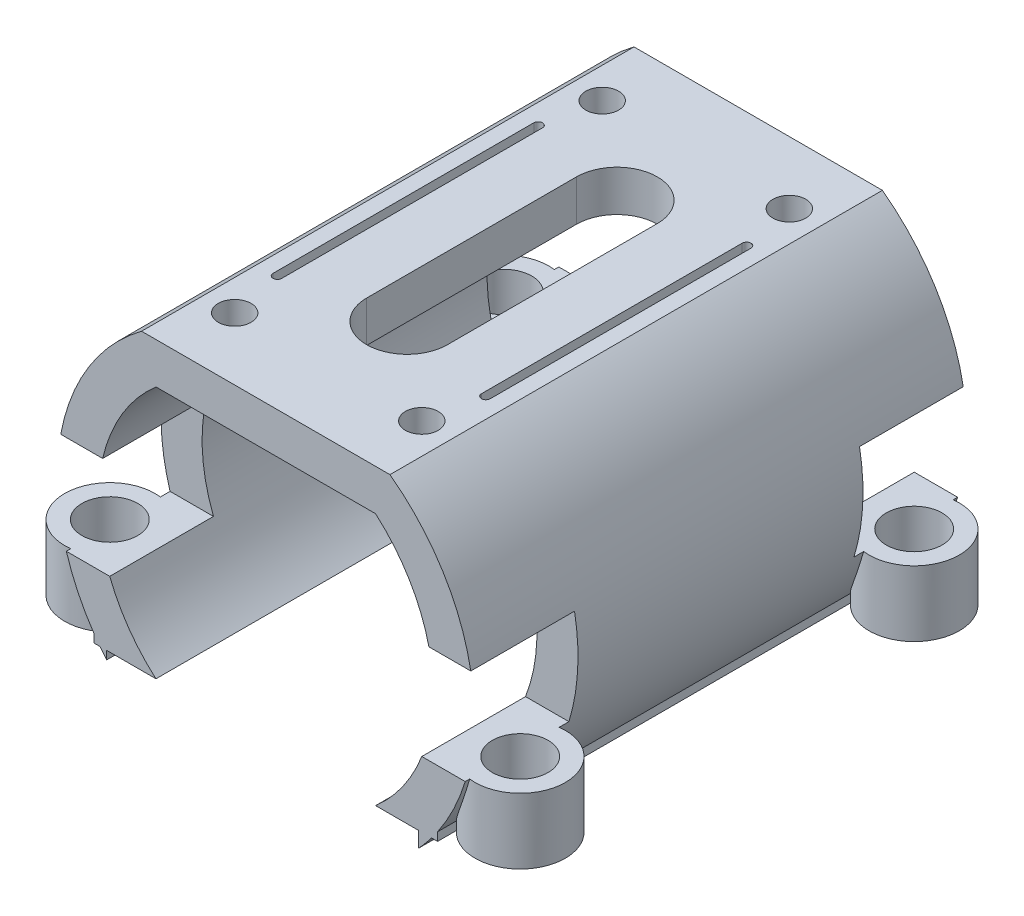
from build123d import *

# Parameters (mm, degrees)
SALIENTE_EXTRUIR1_DEPTH    = 30
VACIADO1_T                 = 2.5
CROQUIS2_W                 = 41.64599518
CROQUIS2_H                 = 31.401201606
CORTAR_EXTRUIR1_DEPTH      = 2.5
CROQUIS3_W                 = 19.002401527
CROQUIS3_H                 = 2.972205444
CORTAR_EXTRUIR2_DEPTH      = 48.3
CROQUIS4_R                 = 2.75
CROQUIS4_R_2               = 1.7
SALIENTE_EXTRUIR2_DEPTH    = 4
SALIENTE_EXTRUIR2_2_DEPTH  = 4
SALIENTE_EXTRUIR2_3_DEPTH  = 4
SALIENTE_EXTRUIR2_4_DEPTH  = 4
CROQUIS5_W                 = 2.061100057
CROQUIS5_H                 = 29.9
SALIENTE_EXTRUIR3_DEPTH    = 1.5
CROQUIS6_R                 = 1
CORTAR_EXTRUIR3_DEPTH      = 7
CORTAR_EXTRUIR4_DEPTH      = 30
CORTAR_EXTRUIR4_DEPTH_BACK = 32
CROQUIS9_W                 = 7.755534198
CROQUIS9_H                 = 6.000416911
CROQUIS10_R                = 1.7
CORTAR_EXTRUIR5_DEPTH      = 9


with BuildPart() as part:
    # Croquis1 → Saliente-Extruir1 (new body)
    with BuildSketch(Plane.XY):
        with BuildLine():
            Line((-6.68954408, 7.7), (6.68954408, 7.7))
            ThreePointArc((6.68954408, 7.7), (10.2, 0), (6.68954408, -7.7))
            Line((6.68954408, -7.7), (-6.68954408, -7.7))
            ThreePointArc((-6.68954408, -7.7), (-10.2, 0), (-6.68954408, 7.7))
        make_face()
    extrude(amount=SALIENTE_EXTRUIR1_DEPTH)

    # Vaciado1
    vaciado1_openings = [part.faces().sort_by_distance(p)[0] for p in [
        (0, 0, 30),
    ]]
    offset(amount=VACIADO1_T, openings=vaciado1_openings, kind=Kind.INTERSECTION)

    # Croquis2 → Cortar-Extruir1 (cut)
    with BuildSketch(Plane(origin=(0, 0, -2.5), x_dir=(-1, 0, 0), z_dir=(0, 0, -1))):
        Rectangle(CROQUIS2_W, CROQUIS2_H)
    extrude(amount=-CORTAR_EXTRUIR1_DEPTH, mode=Mode.SUBTRACT)

    # Croquis3 → Cortar-Extruir2 (cut)
    with BuildSketch(Plane.XY.offset(30)):
        with Locations((-0.191367802, -9.186102722)):
            Rectangle(CROQUIS3_W, CROQUIS3_H)
    extrude(amount=-CORTAR_EXTRUIR2_DEPTH, mode=Mode.SUBTRACT)



with BuildPart() as body_2:
    # Croquis4 → Saliente-Extruir2 (new body)
    with BuildSketch(Plane.XZ.offset(7.7)):
        with Locations((12.5, 3)):
            Circle(CROQUIS4_R)
        with Locations((12.5, 3)):
            Circle(CROQUIS4_R_2, mode=Mode.SUBTRACT)
    extrude(amount=-SALIENTE_EXTRUIR2_DEPTH)


with BuildPart() as body_3:
    # Croquis4 → Saliente-Extruir2 2 (new body)
    with BuildSketch(Plane.XZ.offset(7.7)):
        with Locations((12.5, 27)):
            Circle(CROQUIS4_R)
        with Locations((12.5, 27)):
            Circle(CROQUIS4_R_2, mode=Mode.SUBTRACT)
    extrude(amount=-SALIENTE_EXTRUIR2_2_DEPTH)


with BuildPart() as body_4:
    # Croquis4 → Saliente-Extruir2 3 (new body)
    with BuildSketch(Plane.XZ.offset(7.7)):
        with Locations((-12.5, 27)):
            Circle(CROQUIS4_R)
        with Locations((-12.5, 27)):
            Circle(CROQUIS4_R_2, mode=Mode.SUBTRACT)
    extrude(amount=-SALIENTE_EXTRUIR2_3_DEPTH)


with BuildPart() as body_5:
    # Croquis4 → Saliente-Extruir2 4 (new body)
    with BuildSketch(Plane.XZ.offset(7.7)):
        with Locations((-12.5, 3)):
            Circle(CROQUIS4_R)
        with Locations((-12.5, 3)):
            Circle(CROQUIS4_R_2, mode=Mode.SUBTRACT)
    extrude(amount=-SALIENTE_EXTRUIR2_4_DEPTH)


with BuildPart() as part_1:
    add(part.part)

    add(body_2.part)  # Saliente-Extruir3 merges body 2

    add(body_3.part)  # Saliente-Extruir3 merges body 3

    add(body_4.part)  # Saliente-Extruir3 merges body 4

    add(body_5.part)  # Saliente-Extruir3 merges body 5
    # Croquis5 → Saliente-Extruir3 (add)
    with BuildSketch(Plane.XZ.offset(7.7)):
        with Locations((-9.437095098, 15.05)):
            Rectangle(CROQUIS5_W, CROQUIS5_H)
        with Locations((9.437095098, 15.05)):
            Rectangle(CROQUIS5_W, CROQUIS5_H)
    extrude(amount=-SALIENTE_EXTRUIR3_DEPTH)

    # Croquis6 → Cortar-Extruir3 (cut)
    with BuildSketch(Plane(origin=(0, 10.2, 0), x_dir=(1, 0, 0), z_dir=(0, 1, 0))):
        with Locations((5.7, -3.804995741)):
            Circle(CROQUIS6_R)
        with Locations((5.7, -26.195004259)):
            Circle(CROQUIS6_R)
        with Locations((-5.7, -3.804995741)):
            Circle(CROQUIS6_R)
        with Locations((-5.7, -26.195004259)):
            Circle(CROQUIS6_R)
        with BuildLine():
            Line((-2.462626263, -21.392483276), (-2.462626263, -8.607516724))
            ThreePointArc((-2.462626263, -8.607516724), (0, -6.144890461), (2.462626263, -8.607516724))
            Line((2.462626263, -8.607516724), (2.462626263, -21.392483276))
            ThreePointArc((2.462626263, -21.392483276), (0, -23.855109539), (-2.462626263, -21.392483276))
        make_face()
        with BuildLine():
            Line((6.616453694, -7.057894038), (6.616453694, -22.942105962))
            ThreePointArc((6.616453694, -22.942105962), (6.35, -23.208559655), (6.083546306, -22.942105962))
            Line((6.083546306, -22.942105962), (6.083546306, -7.057894038))
            ThreePointArc((6.083546306, -7.057894038), (6.35, -6.791440345), (6.616453694, -7.057894038))
        make_face()
        with BuildLine():
            Line((-6.616453694, -7.057894038), (-6.616453694, -22.942105962))
            ThreePointArc((-6.616453694, -22.942105962), (-6.35, -23.208559655), (-6.083546306, -22.942105962))
            Line((-6.083546306, -22.942105962), (-6.083546306, -7.057894038))
            ThreePointArc((-6.083546306, -7.057894038), (-6.35, -6.791440345), (-6.616453694, -7.057894038))
        make_face()
    extrude(amount=-CORTAR_EXTRUIR3_DEPTH, mode=Mode.SUBTRACT)

    # Croquis9 → Cortar-Extruir4 (cut, two sides: drawn at the far end of the back side and taken through both)
    with BuildSketch(Plane(origin=(0, 0, 0), x_dir=(0, 0, -1), z_dir=(1, 0, 0)).offset(-CORTAR_EXTRUIR4_DEPTH_BACK)):
        with Locations((-2.44087865, -0.699791545)):
            Rectangle(CROQUIS9_W, CROQUIS9_H)
        with Locations((-27.55912135, -0.699791545)):
            Rectangle(CROQUIS9_W, CROQUIS9_H)
    extrude(amount=CORTAR_EXTRUIR4_DEPTH + CORTAR_EXTRUIR4_DEPTH_BACK, mode=Mode.SUBTRACT)

    # Croquis10 → Cortar-Extruir5 (cut)
    with BuildSketch(Plane.XZ.offset(7.7)):
        with Locations((12.5, 27)):
            Circle(CROQUIS10_R)
        with Locations((-12.5, 27)):
            Circle(CROQUIS10_R)
        with Locations((12.5, 3)):
            Circle(CROQUIS10_R)
        with Locations((-12.5, 3)):
            Circle(CROQUIS10_R)
    extrude(amount=-CORTAR_EXTRUIR5_DEPTH, mode=Mode.SUBTRACT)


solid = part_1.part
